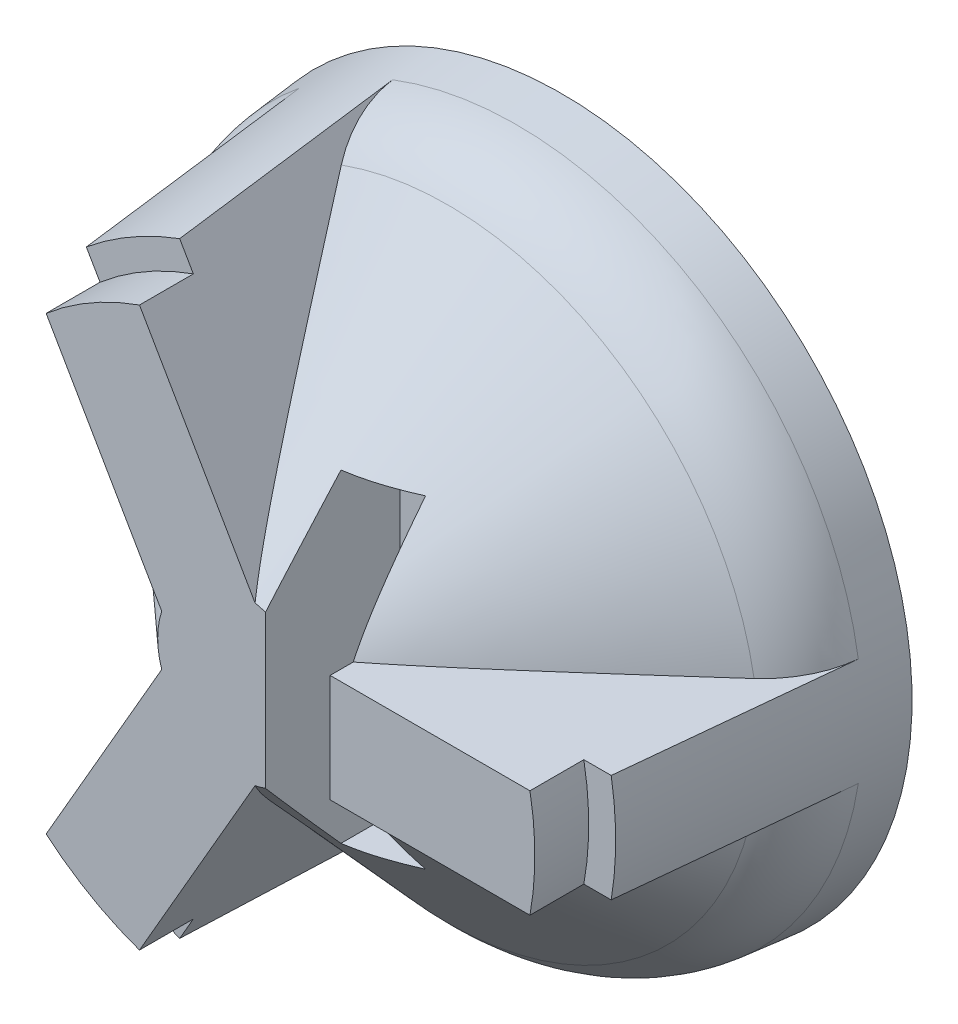
from build123d import *

# Parameters (mm, degrees)
BOSS_EXTRU_1_DEPTH      = 12
ESQUISSE5_R             = 12.2
ENL_V_MAT_EXTRU_1_DEPTH = 2.5
CONG_2_R                = 4
ESQUISSE7_W             = 2.4
ESQUISSE7_H             = 12
ENL_V_MAT_EXTRU_2_DEPTH = 5


with BuildPart() as part:
    # Esquisse1 → Boss.-Extru.1 (new body)
    with BuildSketch(Plane.XY):
        with BuildLine():
            ThreePointArc((13.856406461, -2), (14, 0), (13.856406461, 2))
            Line((13.856406461, 2), (2.236067977, 2))
            ThreePointArc((2.236067977, 2), (1.891817848, 2.328309522), (1.5, 2.598076211))
            ThreePointArc((1.5, 2.598076211), (1.070466269, 2.802517077), (0.614016819, 2.936491673))
            Line((0.614016819, 2.936491673), (-5.196152423, 13))
            ThreePointArc((-5.196152423, 13), (-7, 12.124355653), (-8.660254038, 11))
            Line((-8.660254038, 11), (-2.850084796, 0.936491673))
            ThreePointArc((-2.850084796, 0.936491673), (-2.962284118, 0.474207555), (-3, 0))
            ThreePointArc((-3, 0), (-2.962284118, -0.474207555), (-2.850084796, -0.936491673))
            Line((-2.850084796, -0.936491673), (-8.660254038, -11))
            ThreePointArc((-8.660254038, -11), (-7, -12.124355653), (-5.196152423, -13))
            Line((-5.196152423, -13), (0.614016819, -2.936491673))
            ThreePointArc((0.614016819, -2.936491673), (1.070466269, -2.802517077), (1.5, -2.598076211))
            ThreePointArc((1.5, -2.598076211), (1.891817848, -2.328309522), (2.236067977, -2))
            Line((2.236067977, -2), (13.856406461, -2))
        make_face()
    extrude(amount=BOSS_EXTRU_1_DEPTH)

    # Esquisse4 → Révolution1 (revolve)
    with BuildSketch(Plane(origin=(0, 0, 0), x_dir=(1, 0, 0), z_dir=(0, 1, 0))):
        Polygon((3, -12), (0, -12), (0, 0), (14, 0), (14, -2), align=None)
    revolve(axis=Axis((0, 0, 12), (0, 0, -1)))

    # Esquisse5 → Enlèv. mat.-Extru.1 (cut)
    with BuildSketch(Plane(origin=(0, 0, 0), x_dir=(-1, 0, 0), z_dir=(0, 0, -1))):
        Circle(ESQUISSE5_R)
    extrude(amount=-ENL_V_MAT_EXTRU_1_DEPTH, mode=Mode.SUBTRACT)

    # Esquisse6 → Enlèvement de matière-Révolution1 (revolve, cut)
    with BuildSketch(Plane(origin=(0, 0, 0), x_dir=(1, 0, 0), z_dir=(0, 1, 0))):
        Polygon((13, 0), (15.480754368, 0), (15.480754368, -12), (11.8, -12), (11, -12), (11, -10), (12, -10), align=None)
    revolve(axis=Axis((0, 0, 0), (0, 0, 1)), mode=Mode.SUBTRACT)

    # Congé2
    cong_2_edges = [part.edges().sort_by_distance(p)[0] for p in [
        (6.34, -10.98120212, 3.2),
        (-12.68, 0, 3.2),
        (6.34, 10.98120212, 3.2),
    ]]
    fillet(cong_2_edges, radius=CONG_2_R)

    # Esquisse7 → Enlèv. mat.-Extru.2 (cut)
    with BuildSketch(Plane.XY.offset(12)):
        with Locations((2.2, 0)):
            Rectangle(ESQUISSE7_W, ESQUISSE7_H)
    extrude(amount=-ENL_V_MAT_EXTRU_2_DEPTH, mode=Mode.SUBTRACT)


solid = part.part
